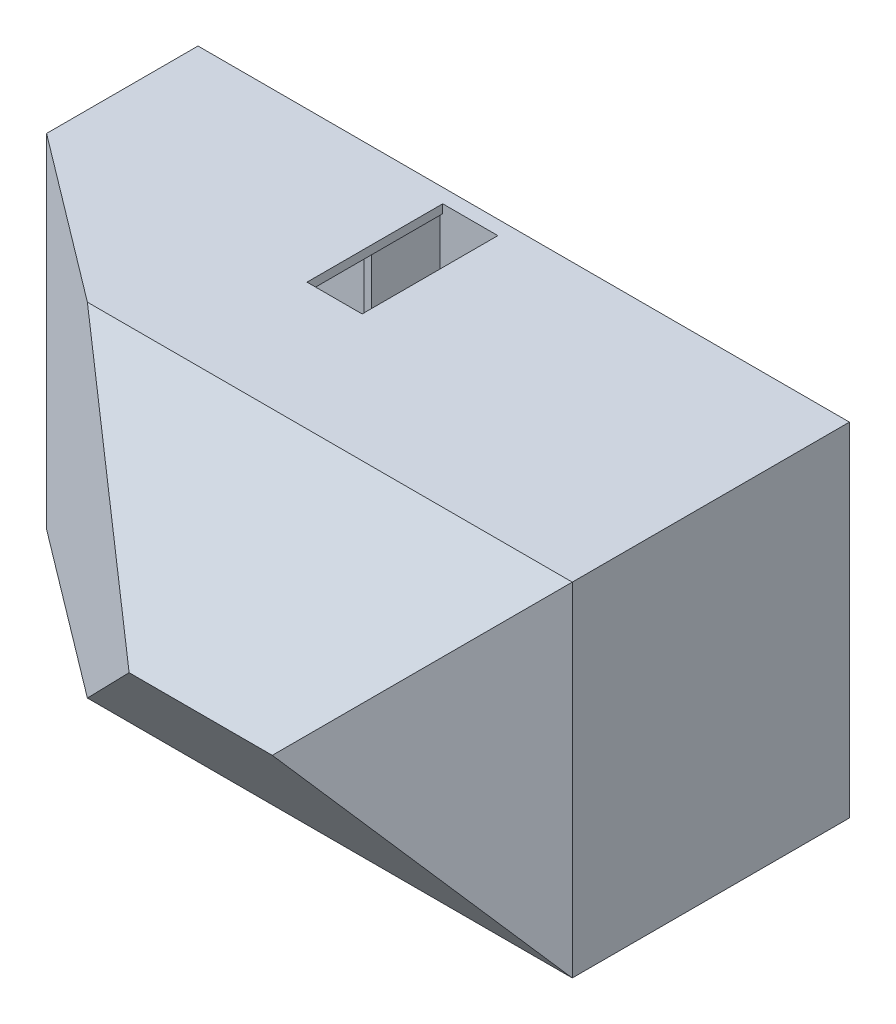
from build123d import *

# Parameters (mm, degrees)
SKETCH3_W                        = 11582.4
SKETCH3_H                        = 6096
SKETCH3_W_2                      = 3708.4
SKETCH3_H_2                      = 2342.798643186
SKETCH3_H_3                      = 2330.801356814
BOSS_EXTRUDE1_DEPTH              = 2438.4
SKETCH4_W                        = 11582.4
SKETCH4_H                        = 6096
BOSS_EXTRUDE2_DEPTH              = 254
BOSS_EXTRUDE3_DEPTH              = 914.4
SKETCH9_W                        = 865.543163862
SKETCH9_H                        = 991.415413209
CUT_EXTRUDE1_DEPTH               = 308.356
BOSS_EXTRUDE4_REACH              = 13183.499
BOSS_EXTRUDE7_DEPTH              = 254
BOSS_EXTRUDE7_DEPTH_BACK         = 25.4
CUT_EXTRUDE2_REACH               = 12509.597
BOSS_EXTRUDE8_DEPTH              = 1981.2
BOSS_EXTRUDE9_DEPTH              = 152.4
BOSS_EXTRUDE10_DEPTH             = 11509.502
BOSS_EXTRUDE11_REACH             = 14825.941
SKETCH17_W                       = 9126.052100072
SKETCH17_H                       = 6096
CUT_EXTRUDE3_DEPTH               = 3950.208
SKETCH18_W                       = 6162.012197425
SKETCH18_H                       = 5468.61546298
CUT_EXTRUDE4_DEPTH               = 3950.208
SKETCH19_W                       = 10778.647149002
SKETCH19_H                       = 6356.86992093
CUT_EXTRUDE5_DEPTH               = 3950.208
BOSS_EXTRUDE12_REACH             = 13849.543
SKETCH20_W                       = 3454.4
SKETCH20_H                       = 101.6
BOSS_EXTRUDE13_REACH             = 13849.543
SKETCH21_W                       = 101.6
SKETCH21_H                       = 1651
SKETCH22_W                       = 532.624565481
SKETCH22_H                       = 1281.986841564
CUT_EXTRUDE7_DEPTH               = 1185.672
SKETCH23_W                       = 128.189543518
SKETCH23_H                       = 2423.836870905
BOSS_EXTRUDE14_DEPTH             = 1219.2
BOSS_EXTRUDE15_REACH             = 14294.145
SKETCH24_W                       = 128.189543518
SKETCH24_H                       = 134.329985605
BOSS_EXTRUDE18_DEPTH             = 2399.284
BOSS_EXTRUDE18_DEPTH_BACK        = 2122.678
SKETCH26_W                       = 128.189543518
SKETCH26_H                       = 159.351168061
BOSS_EXTRUDE19_DEPTH             = 4241.8
BOSS_EXTRUDE19_DEPTH_BACK        = 3574.034
SKETCH27_W                       = 159.351168061
SKETCH27_H                       = 134.329985605
SKETCH33_W                       = 159.351168061
SKETCH33_H                       = 110.164485909
BOSS_EXTRUDE22_DEPTH             = 2592.07
BOSS_EXTRUDE23_DEPTH             = 2412.746
BOSS_EXTRUDE23_DEPTH_BACK        = 3589.528
SKETCH34_W                       = 128.189543518
SKETCH34_H                       = 150.52485229
BOSS_EXTRUDE24_REACH             = 11698.577
SKETCH35_W                       = 147.733032468
SKETCH35_H                       = 225.221764686
BOSS_EXTRUDE24_DIRECTION_2_DEPTH = 3311.398
SKETCH36_W                       = 117.495674419
SKETCH36_H                       = 147.733032468
BOSS_EXTRUDE25_DEPTH             = 2412.746
BOSS_EXTRUDE26_REACH             = 13768.706
SKETCH37_W                       = 172.313632774
SKETCH37_H                       = 139.095631101
BOSS_EXTRUDE27_DEPTH             = 3289.554
BOSS_EXTRUDE27_DEPTH_BACK        = 2668.016
SKETCH42_W                       = 172.313632774
SKETCH42_H                       = 147.733032468
SKETCH43_W                       = 171.607694654
SKETCH43_H                       = 159.351168061
BOSS_EXTRUDE28_DEPTH             = 3409.442
BOSS_EXTRUDE29_START             = 3519.763129095
BOSS_EXTRUDE29_DEPTH             = 134.329985605
SKETCH25_W                       = 5842
SKETCH25_H                       = 152.4
BOSS_EXTRUDE17_DEPTH             = 2235.2
BOSS_EXTRUDE20_REACH             = 14825.941
SKETCH29_W                       = 4249.880047705
SKETCH29_H                       = 6867.48766491
CUT_EXTRUDE8_DEPTH               = 4333.494
SKETCH30_W                       = 5475.233712052
SKETCH30_H                       = 5083.463062498
CUT_EXTRUDE9_DEPTH               = 4333.494
SKETCH31_W                       = 5267.827918063
SKETCH31_H                       = 4526.494518998
CUT_EXTRUDE10_DEPTH              = 4333.494
BOSS_EXTRUDE21_DEPTH             = 2687.32
SKETCH38_W                       = 5170.59012186
SKETCH38_H                       = 1946.673235559
CUT_EXTRUDE11_DEPTH              = 2412.746
SKETCH39_W                       = 8812.500446969
SKETCH39_H                       = 7026.305940655
CUT_EXTRUDE12_DEPTH              = 2412.746
SKETCH40_W                       = 7455.191850554
SKETCH40_H                       = 6034.724471262
CUT_EXTRUDE13_DEPTH              = 2412.746
SKETCH41_W                       = 6175.122976302
SKETCH41_H                       = 7375.841332805
CUT_EXTRUDE14_DEPTH              = 2412.746
SKETCH45_W                       = 5842
SKETCH45_H                       = 152.4
BOSS_EXTRUDE30_DEPTH             = 2235.2
SKETCH46_W                       = 6467.572168299
SKETCH46_H                       = 1492.516654223
CUT_EXTRUDE15_DEPTH              = 2235.2
SKETCH47_W                       = 980.476105055
SKETCH47_H                       = 2413
CUT_EXTRUDE16_DEPTH              = 2235.2
SKETCH48_W                       = 980.476105055
SKETCH48_H                       = 2413
CUT_EXTRUDE17_DEPTH              = 463.804
SKETCH49_W                       = 841.116574167
SKETCH49_H                       = 2290.952430173
CUT_EXTRUDE18_DEPTH              = 463.804
SKETCH50_W                       = 859.629187762
SKETCH50_H                       = 2304.601646796
CUT_EXTRUDE19_DEPTH              = 463.804
SKETCH51_W                       = 859.629187762
SKETCH51_H                       = 2304.601646796
CUT_EXTRUDE20_DEPTH              = 463.804
SKETCH52_W                       = 926.009779554
SKETCH52_H                       = 2273.025271102
CUT_EXTRUDE21_DEPTH              = 463.804


# Read off the part's stored shape, not the designer's step: Boss-Extrude29
with BuildPart() as part:
    # Sketch3 → Boss-Extrude1 (new body)
    with BuildSketch(Plane.XY):
        with Locations((5791.2, 3048)):
            Rectangle(SKETCH3_W, SKETCH3_H)
        Polygon((6096, 2495.198643186), (7620, 2495.198643186), (7620, 152.4), (7421.082242954, 152.4), (6096, 152.4), align=None, mode=Mode.SUBTRACT)
        with Locations((9575.8, 1323.799321593)):
            Rectangle(SKETCH3_W_2, SKETCH3_H_2, mode=Mode.SUBTRACT)
        Polygon((4452.687217937, 152.4), (152.4, 152.4), (152.4, 2489.2), (3454.4, 2489.2), (3454.4, 2590.8), (152.4, 2590.8), (152.4, 5943.6), (5973.282242954, 5943.6), (6074.882242954, 5943.6), (7620, 5943.6), (7620, 3621.363129095), (7620, 3519.763129095), (10289.03652981, 3519.763129095), (10390.63652981, 3519.763129095), (11430, 3511.198643186), (11430, 2596.798643186), (10390.63652981, 2605.363129095), (10289.03652981, 2605.363129095), (7620, 2605.363129095), (5994.4, 2605.363129095), (5994.4, 152.4), (4554.287217937, 152.4), (4554.287217937, 1803.4), (4452.687217937, 1803.4), align=None, mode=Mode.SUBTRACT)
        with Locations((9575.8, 4778.199321593)):
            Rectangle(SKETCH3_W_2, SKETCH3_H_3, mode=Mode.SUBTRACT)
    extrude(amount=BOSS_EXTRUDE1_DEPTH)

    # Sketch4 → Boss-Extrude2 (add)
    with BuildSketch(Plane(origin=(0, 0, 0), x_dir=(-1, 0, 0), z_dir=(0, 0, -1))):
        with Locations((-5791.2, 3048)):
            Rectangle(SKETCH4_W, SKETCH4_H)
    extrude(amount=BOSS_EXTRUDE2_DEPTH)

    # Sketch8 → Boss-Extrude3 (add)
    with BuildSketch(Plane.XZ.offset(-3519.763129095)):
        Polygon((8839.2, 0), (10563.649079736, 1446.984586791), (11430, 1446.984586791), (11430, 1319.984586791), (10609.873299488, 1319.984586791), (9036.776926011, 0), align=None)
    extrude(amount=BOSS_EXTRUDE3_DEPTH)

    # Sketch9 → Cut-Extrude1 (cut)
    with BuildSketch(Plane(origin=(22.172535688, 2690.800578374, 0), x_dir=(0.9999660518909057, -0.008239846219105333, 0), z_dir=(0.008239846219105333, 0.9999660518909057, 0))):
        with Locations((10967.071485942, -1942.692293396)):
            Rectangle(SKETCH9_W, SKETCH9_H)
    extrude(amount=-CUT_EXTRUDE1_DEPTH, mode=Mode.SUBTRACT)

    # Boss-Extrude4: up to this plane
    boss_extrude4_end = Plane(origin=(10553.574014115, 2295.654035243, 1446.984586791), z_dir=(-0.9999660518909057, 0.008239846219105333, 0))
    # Sketch10 → Boss-Extrude4 (add, up to the surface)
    with BuildSketch(Plane.ZY.offset(-11430), mode=Mode.PRIVATE) as boss_extrude4_sk1:
        Polygon((1446.984586791, 2605.363129095), (2438.4, 1423.840248649), (2438.4, 1313.675762741), (1446.984586791, 2495.198643186), (1319.984586791, 2495.198643186), (1319.984586791, 2605.363129095), align=None)
    boss_extrude4_tool1 = split(extrude(boss_extrude4_sk1.sketch, amount=BOSS_EXTRUDE4_REACH, mode=Mode.PRIVATE), bisect_by=boss_extrude4_end, keep=Keep.BOTH, mode=Mode.PRIVATE)
    add(boss_extrude4_tool1.solids().sort_by_distance((11430, 2026.602483, 1879.192293))[0])

    # Sketch11 → Boss-Extrude7 (add, two sides: drawn at the far end of the back side and taken through both)
    with BuildSketch(Plane.XY.offset(2438.4).offset(-BOSS_EXTRUDE7_DEPTH_BACK)):
        Polygon((5994.4, 2605.363129095), (5994.4, 0), (11582.4, 0), (11582.4, 1423.840248649), (11582.4, 3612.798643186), (11582.4, 6096), (7620, 6096), (5994.4, 6096), (5994.4, 5943.6), (7620, 5943.6), (7620, 3519.763129095), (7620, 2605.363129095), align=None)
        Polygon((11430, 1423.840248649), (10546.390158704, 1423.840248649), (10556.114820136, 2603.999567139), (9336.915582645, 2605.363129095), (9336.915582645, 3519.763129095), (11430, 3511.198643186), align=None, mode=Mode.SUBTRACT)
    extrude(amount=BOSS_EXTRUDE7_DEPTH + BOSS_EXTRUDE7_DEPTH_BACK)

    # Cut-Extrude2: up to this plane
    cut_extrude2_end = Plane(origin=(11430, 0, 2438.4), z_dir=(-1, 0, 0))
    # Sketch12 → Cut-Extrude2 (cut, up to the surface)
    with BuildSketch(Plane(origin=(10533.942284448, -86.801011235, 0), x_dir=(0, 0, -1), z_dir=(0.9999660518909057, -0.008239846219105333, 0)), mode=Mode.PRIVATE) as cut_extrude2_sk1:
        Polygon((-2438.4, 1519.229106813), (-2692.4, 1216.533970571), (-2692.4, 1519.229106813), align=None)
    cut_extrude2_tool1 = split(extrude(cut_extrude2_sk1.sketch, amount=CUT_EXTRUDE2_REACH, mode=Mode.PRIVATE), bisect_by=cut_extrude2_end, keep=Keep.BOTH, mode=Mode.PRIVATE)
    add(cut_extrude2_tool1.solids().sort_by_distance((10545.629112, 1331.481567, 2607.733333))[0], mode=Mode.SUBTRACT)

    # Sketch13 → Boss-Extrude8 (add)
    with BuildSketch(Plane.XY.offset(2692.4)):
        Polygon((7620, 6096), (11582.4, 6096), (11582.4, 3511.198643186), (11582.4, 0), (5994.4, 0), (5994.4, 152.4), (11430, 152.4), (11430, 3511.198643186), (9336.915582645, 3519.763129095), (9336.915582645, 2605.363129095), (7620, 2605.363129095), (7620, 5943.6), (5994.4, 5943.6), (5994.4, 6096), align=None)
        Polygon((7721.6, 2706.963129095), (7721.6, 5943.6), (11430, 5943.6), (11430, 3613.380649927), (9235.315582645, 3621.751379922), (9235.315582645, 2706.963129095), align=None, mode=Mode.SUBTRACT)
    extrude(amount=BOSS_EXTRUDE8_DEPTH)

    # Sketch14 → Boss-Extrude9 (add)
    with BuildSketch(Plane(origin=(11582.4, 0, 0), x_dir=(0, 0, -1), z_dir=(1, 0, 0))):
        Polygon((-4673.6, 0), (-4673.6, 6096), (-6959.6, 3048), align=None)
    extrude(amount=-BOSS_EXTRUDE9_DEPTH)

    # Sketch15 → Boss-Extrude10 (add)
    with BuildSketch(Plane.ZY.offset(-11430)):
        Polygon((4673.6, 6096), (6959.6, 3048), (4673.6, 0), (4673.6, 152.4), (6845.3, 3048), (4673.6, 5943.6), align=None)
    extrude(amount=BOSS_EXTRUDE10_DEPTH)

    # Boss-Extrude11: up to this face of the body (flat: up to its plane)
    boss_extrude11_end = Plane(part.part.faces().sort_by_distance((6648.35244623, 6096, 1796.808366816))[0])
    # Sketch16 → Boss-Extrude11 (add, up to the picked face)
    with BuildSketch(Plane.XZ, mode=Mode.PRIVATE) as boss_extrude11_sk1:
        Polygon((0, 2438.4), (5988.840887926, 6959.6), (5988.840887926, 6845.3), (152.4, 2438.4), align=None)
    boss_extrude11_tool1 = split(extrude(boss_extrude11_sk1.sketch, amount=-BOSS_EXTRUDE11_REACH, mode=Mode.PRIVATE), bisect_by=boss_extrude11_end, keep=Keep.BOTH, mode=Mode.PRIVATE)
    add(boss_extrude11_tool1.solids().sort_by(Axis((3029.082751, 0, 4668.075048), (0, 1, 0)))[0])

    # Sketch17 → Cut-Extrude3 (cut)
    with BuildSketch(Plane(origin=(-1172.561069115, 0, 1553.189789061), x_dir=(0.7981045533386113, 0, 0.6025189805642441), z_dir=(-0.6025189805642441, 0, 0.7981045533386113))):
        with Locations((4409.986228973, 3048)):
            Rectangle(SKETCH17_W, SKETCH17_H)
    extrude(amount=CUT_EXTRUDE3_DEPTH, mode=Mode.SUBTRACT)

    # Sketch18 → Cut-Extrude4 (cut)
    with BuildSketch(Plane(origin=(0, -2243.328, 2991.104), x_dir=(1, 0, 0), z_dir=(0, -0.6000000000000002, 0.7999999999999999))):
        with Locations((4789.474642924, 4319.26773149)):
            Rectangle(SKETCH18_W, SKETCH18_H)
    extrude(amount=CUT_EXTRUDE4_DEPTH, mode=Mode.SUBTRACT)

    # Sketch19 → Cut-Extrude5 (cut)
    with BuildSketch(Plane(origin=(0, 4437.888, 5917.184), x_dir=(1, 0, 0), z_dir=(0, 0.5999999999999998, 0.8000000000000004))):
        with Locations((7188.072546938, 83.612963585)):
            Rectangle(SKETCH19_W, SKETCH19_H)
    extrude(amount=CUT_EXTRUDE5_DEPTH, mode=Mode.SUBTRACT)

    # Boss-Extrude12: up to this face of the body (flat: up to its plane)
    boss_extrude12_end = Plane(part.part.faces().sort_by_distance((2402.66330701, 3048, 4137.498056176))[0])
    # Sketch20 → Boss-Extrude12 (add, up to the picked face)
    with BuildSketch(Plane.XY.offset(2438.4), mode=Mode.PRIVATE) as boss_extrude12_sk1:
        with Locations((1727.2, 2540)):
            Rectangle(SKETCH20_W, SKETCH20_H)
    boss_extrude12_tool1 = split(extrude(boss_extrude12_sk1.sketch, amount=BOSS_EXTRUDE12_REACH, mode=Mode.PRIVATE), bisect_by=boss_extrude12_end, keep=Keep.BOTH, mode=Mode.PRIVATE)
    add(boss_extrude12_tool1.solids().sort_by(Axis((1727.2, 2540, 2438.4), (0, 0, 1)))[0])

    # Boss-Extrude13: up to this plane
    boss_extrude13_end = Plane(origin=(11430, 0, 4673.6), z_dir=(0, -0.6000000000000002, 0.7999999999999999))
    # Sketch21 → Boss-Extrude13 (add, up to the surface)
    with BuildSketch(Plane.XY.offset(2438.4), mode=Mode.PRIVATE) as boss_extrude13_sk1:
        with Locations((4503.487217937, 977.9)):
            Rectangle(SKETCH21_W, SKETCH21_H)
    boss_extrude13_tool1 = split(extrude(boss_extrude13_sk1.sketch, amount=BOSS_EXTRUDE13_REACH, mode=Mode.PRIVATE), bisect_by=boss_extrude13_end, keep=Keep.BOTH, mode=Mode.PRIVATE)
    add(boss_extrude13_tool1.solids().sort_by_distance((4503.487218, 977.9, 2438.4))[0])

    # Sketch22 → Cut-Extrude7 (cut)
    with BuildSketch(Plane(origin=(-1172.561069115, 0, 1553.189789061), x_dir=(0.7981045533386113, 0, 0.6025189805642441), z_dir=(-0.6025189805642441, 0, 0.7981045533386113))):
        with Locations((7037.092924102, 1579.089259508)):
            Rectangle(SKETCH22_W, SKETCH22_H)
    extrude(amount=CUT_EXTRUDE7_DEPTH, mode=Mode.SUBTRACT)

    # Sketch23 → Boss-Extrude14 (add)
    with BuildSketch(Plane.XY):
        with Locations((4490.192446178, 4731.681564547)):
            Rectangle(SKETCH23_W, SKETCH23_H)
    extrude(amount=BOSS_EXTRUDE14_DEPTH)

    # Boss-Extrude15: up to this plane
    boss_extrude15_end = Plane(origin=(152.4, 13599.829996801, 2438.4), z_dir=(0.6025845157633412, 0, -0.7980550741410393))
    # Sketch24 → Boss-Extrude15 (add, up to the surface)
    with BuildSketch(Plane.XY.offset(1219.2), mode=Mode.PRIVATE) as boss_extrude15_sk1:
        with Locations((4490.192446178, 3586.928121898)):
            Rectangle(SKETCH24_W, SKETCH24_H)
    boss_extrude15_tool1 = split(extrude(boss_extrude15_sk1.sketch, amount=BOSS_EXTRUDE15_REACH, mode=Mode.PRIVATE), bisect_by=boss_extrude15_end, keep=Keep.BOTH, mode=Mode.PRIVATE)
    add(boss_extrude15_tool1.solids().sort_by_distance((4490.192446, 3586.928122, 1219.2))[0])

    # Sketch26 → Boss-Extrude18 (add, two sides: drawn at the far end of the back side and taken through both)
    with BuildSketch(Plane(origin=(0, 3654.0931147, 0), x_dir=(1, 0, 0), z_dir=(0, 1, 0)).offset(-BOSS_EXTRUDE18_DEPTH_BACK)):
        with Locations((4490.192446178, -2492.67558403)):
            Rectangle(SKETCH26_W, SKETCH26_H)
    extrude(amount=BOSS_EXTRUDE18_DEPTH + BOSS_EXTRUDE18_DEPTH_BACK)

    # Sketch27 → Boss-Extrude19 (add, two sides: drawn at the far end of the back side and taken through both)
    with BuildSketch(Plane.ZY.offset(-4426.097674419).offset(-BOSS_EXTRUDE19_DEPTH_BACK)):
        with Locations((2492.67558403, 3586.928121898)):
            Rectangle(SKETCH27_W, SKETCH27_H)
    extrude(amount=BOSS_EXTRUDE19_DEPTH + BOSS_EXTRUDE19_DEPTH_BACK)

    # Sketch33 → Boss-Extrude22 (add)
    with BuildSketch(Plane.ZY.offset(-5994.4)):
        with Locations((2492.67558403, 2550.280886141)):
            Rectangle(SKETCH33_W, SKETCH33_H)
    extrude(amount=BOSS_EXTRUDE22_DEPTH)

    # Sketch34 → Boss-Extrude23 (add, two sides: drawn at the far end of the back side and taken through both)
    with BuildSketch(Plane(origin=(0, 3654.0931147, 0), x_dir=(1, 0, 0), z_dir=(0, 1, 0)).offset(-BOSS_EXTRUDE23_DEPTH_BACK)):
        with Locations((4490.192446178, -4598.337573855)):
            Rectangle(SKETCH34_W, SKETCH34_H)
    extrude(amount=BOSS_EXTRUDE23_DEPTH + BOSS_EXTRUDE23_DEPTH_BACK)

    # Boss-Extrude24: up to this plane
    boss_extrude24_end = Plane(origin=(152.4, 13599.829996801, 2438.4), z_dir=(0.6025845157633412, 0, -0.7980550741410393))
    # Sketch35 → Boss-Extrude24 (add, up to the surface)
    with BuildSketch(Plane.ZY.offset(-4426.097674419), mode=Mode.PRIVATE) as boss_extrude24_sk1:
        with Locations((4599.733483766, 2601.810882343)):
            Rectangle(SKETCH35_W, SKETCH35_H)
    boss_extrude24_tool1 = split(extrude(boss_extrude24_sk1.sketch, amount=BOSS_EXTRUDE24_REACH, mode=Mode.PRIVATE), bisect_by=boss_extrude24_end, keep=Keep.BOTH, mode=Mode.PRIVATE)
    add(boss_extrude24_tool1.solids().sort_by_distance((4426.097674, 2601.810882, 4599.733484))[0])

    # Sketch35 → Boss-Extrude24 direction 2 (add)
    with BuildSketch(Plane.ZY.offset(-4426.097674419)):
        with Locations((4599.733483766, 2601.810882343)):
            Rectangle(SKETCH35_W, SKETCH35_H)
    extrude(amount=-BOSS_EXTRUDE24_DIRECTION_2_DEPTH)

    # Sketch36 → Boss-Extrude25 (add)
    with BuildSketch(Plane.XZ.offset(-2489.2)):
        with Locations((7678.74783721, 4599.733483766)):
            Rectangle(SKETCH36_W, SKETCH36_H)
    extrude(amount=BOSS_EXTRUDE25_DEPTH)

    # Boss-Extrude26: up to this plane
    boss_extrude26_end = Plane(origin=(-79.502, 152.4, 4673.6), z_dir=(0, -0.5999999999999998, 0.8000000000000003))
    # Sketch37 → Boss-Extrude26 (add, up to the surface)
    with BuildSketch(Plane.XY.offset(2692.4), mode=Mode.PRIVATE) as boss_extrude26_sk1:
        with Locations((6080.556816387, 2535.815313544)):
            Rectangle(SKETCH37_W, SKETCH37_H)
    boss_extrude26_tool1 = split(extrude(boss_extrude26_sk1.sketch, amount=BOSS_EXTRUDE26_REACH, mode=Mode.PRIVATE), bisect_by=boss_extrude26_end, keep=Keep.BOTH, mode=Mode.PRIVATE)
    add(boss_extrude26_tool1.solids().sort_by_distance((6080.556816, 2535.815314, 2692.4))[0])

    # Sketch42 → Boss-Extrude27 (add, two sides: drawn at the far end of the back side and taken through both)
    with BuildSketch(Plane(origin=(0, 2714.421764686, 0), x_dir=(1, 0, 0), z_dir=(0, 1, 0)).offset(-BOSS_EXTRUDE27_DEPTH_BACK)):
        with Locations((6080.556816387, -4599.733483766)):
            Rectangle(SKETCH42_W, SKETCH42_H)
    extrude(amount=BOSS_EXTRUDE27_DEPTH + BOSS_EXTRUDE27_DEPTH_BACK)

    # Sketch43 → Boss-Extrude28 (add)
    with BuildSketch(Plane(origin=(0, 2605.363129095, 0), x_dir=(1, 0, 0), z_dir=(0, 1, 0))):
        with Locations((6080.203847327, -2492.67558403)):
            Rectangle(SKETCH43_W, SKETCH43_H)
    extrude(amount=BOSS_EXTRUDE28_DEPTH)

    # Boss-Extrude29 outline → Boss-Extrude29 (add)
    with BuildSketch(Plane(origin=(0, 0, 0), x_dir=(1, 0, 0), z_dir=(0, 1, 0)).offset(BOSS_EXTRUDE29_START)):
        Polygon((2913.316578578, -4523.07514771), (3112.669729899, -4673.6), (4426.097674419, -4673.6), (4426.097674419, -4523.07514771), align=None)
        Polygon((4554.287217937, -4673.6), (5994.4, -4673.6), (5994.4, -4525.866967532), (6166.713632774, -4525.866967532), (6166.713632774, -4673.6), (7620, -4673.6), (7620, -4523.07514771), (4554.287217937, -4523.07514771), align=None)
    extrude(amount=BOSS_EXTRUDE29_DEPTH)

    # Sketch25 → Boss-Extrude17 (add)
    with BuildSketch(Plane.XY.offset(2438.4)):
        with Locations((3073.4, 76.2)):
            Rectangle(SKETCH25_W, SKETCH25_H)
    extrude(amount=BOSS_EXTRUDE17_DEPTH)

    # Boss-Extrude20: up to this face of the body (flat: up to its plane)
    boss_extrude20_end = Plane(part.part.faces().sort_by_distance((5824.630568399, 0, 2201.759416204))[0])
    # Sketch28 → Boss-Extrude20 (add, up to the picked face)
    with BuildSketch(Plane(origin=(0, 6096, 0), x_dir=(1, 0, 0), z_dir=(0, 1, 0)), mode=Mode.PRIVATE) as boss_extrude20_sk1:
        Polygon((11582.4, -4673.6), (11277.6, -4902.2), (8534.4, -6959.6), (8382, -6959.6), (11430, -4673.6), align=None)
    boss_extrude20_tool1 = split(extrude(boss_extrude20_sk1.sketch, amount=-BOSS_EXTRUDE20_REACH, mode=Mode.PRIVATE), bisect_by=boss_extrude20_end, keep=Keep.BOTH, mode=Mode.PRIVATE)
    add(boss_extrude20_tool1.solids().sort_by(Axis((9982.2, 6096, 5816.6), (0, -1, 0)))[0])

    # Sketch29 → Cut-Extrude8 (cut)
    with BuildSketch(Plane(origin=(6412.992, 0, 8550.656), x_dir=(0.8, 0, -0.6), z_dir=(0.6, 0, 0.8))):
        with Locations((4676.549859137, 2949.190131975)):
            Rectangle(SKETCH29_W, SKETCH29_H)
    extrude(amount=CUT_EXTRUDE8_DEPTH, mode=Mode.SUBTRACT)

    # Sketch30 → Cut-Extrude9 (cut)
    with BuildSketch(Plane(origin=(0, -2243.328, 2991.104), x_dir=(1, 0, 0), z_dir=(0, -0.6000000000000003, 0.7999999999999999))):
        with Locations((9740.965191179, 4457.506746783)):
            Rectangle(SKETCH30_W, SKETCH30_H)
    extrude(amount=CUT_EXTRUDE9_DEPTH, mode=Mode.SUBTRACT)

    # Sketch31 → Cut-Extrude10 (cut)
    with BuildSketch(Plane(origin=(0, 4437.888, 5917.184), x_dir=(1, 0, 0), z_dir=(0, 0.6, 0.8))):
        with Locations((9855.451340757, 112.743501572)):
            Rectangle(SKETCH31_W, SKETCH31_H)
    extrude(amount=CUT_EXTRUDE10_DEPTH, mode=Mode.SUBTRACT)

    # Sketch32 → Boss-Extrude21 (add)
    with BuildSketch(Plane.XY.offset(4673.6)):
        Polygon((7620, 5943.6), (7620, 2605.363129095), (9336.915582645, 2605.363129095), (9336.915582645, 3519.763129095), (11430, 3511.198643186), (11430, 3613.380649927), (9235.315582645, 3621.751379922), (9235.315582645, 2706.963129095), (7721.6, 2706.963129095), (7721.6, 5943.6), align=None)
    extrude(amount=BOSS_EXTRUDE21_DEPTH)

    # Sketch38 → Cut-Extrude11 (cut)
    with BuildSketch(Plane(origin=(-1172.561069115, 0, 1553.189789061), x_dir=(0.7981045533386111, 0, 0.6025189805642442), z_dir=(-0.6025189805642442, 0, 0.7981045533386111))):
        with Locations((3185.033968182, 16.696326161)):
            Rectangle(SKETCH38_W, SKETCH38_H)
    extrude(amount=CUT_EXTRUDE11_DEPTH, mode=Mode.SUBTRACT)

    # Sketch39 → Cut-Extrude12 (cut)
    with BuildSketch(Plane(origin=(0, 4437.888, 5917.184), x_dir=(1, 0, 0), z_dir=(0, 0.6, 0.8))):
        with Locations((8852.798105875, 1700.649303399)):
            Rectangle(SKETCH39_W, SKETCH39_H)
    extrude(amount=CUT_EXTRUDE12_DEPTH, mode=Mode.SUBTRACT)

    # Sketch40 → Cut-Extrude13 (cut)
    with BuildSketch(Plane(origin=(0, -2243.328, 2991.104), x_dir=(1, 0, 0), z_dir=(0, -0.6000000000000003, 0.7999999999999999))):
        with Locations((10503.513777939, 4914.283391166)):
            Rectangle(SKETCH40_W, SKETCH40_H)
    extrude(amount=CUT_EXTRUDE13_DEPTH, mode=Mode.SUBTRACT)

    # Sketch41 → Cut-Extrude14 (cut)
    with BuildSketch(Plane(origin=(6412.992, 0, 8550.656), x_dir=(0.8, 0, -0.6), z_dir=(0.6, 0, 0.8))):
        with Locations((5065.956106825, 2899.557218464)):
            Rectangle(SKETCH41_W, SKETCH41_H)
    extrude(amount=CUT_EXTRUDE14_DEPTH, mode=Mode.SUBTRACT)

    # Sketch45 → Boss-Extrude30 (add)
    with BuildSketch(Plane.XY.offset(2438.4)):
        with Locations((3073.4, 6019.8)):
            Rectangle(SKETCH45_W, SKETCH45_H)
    extrude(amount=BOSS_EXTRUDE30_DEPTH)

    # Sketch46 → Cut-Extrude15 (cut)
    with BuildSketch(Plane(origin=(-1172.561069115, 0, 1553.189789061), x_dir=(0.7981045533386111, 0, 0.6025189805642442), z_dir=(-0.6025189805642442, 0, 0.7981045533386111))):
        with Locations((2602.363649901, 6093.815626844)):
            Rectangle(SKETCH46_W, SKETCH46_H)
    extrude(amount=CUT_EXTRUDE15_DEPTH, mode=Mode.SUBTRACT)

    # Sketch47 → Cut-Extrude16 (cut)
    with BuildSketch(Plane.XZ):
        with Locations((5095.412378664, 1206.5)):
            Rectangle(SKETCH47_W, SKETCH47_H)
    extrude(amount=-CUT_EXTRUDE16_DEPTH, mode=Mode.SUBTRACT)

    # Sketch48 → Cut-Extrude17 (cut)
    with BuildSketch(Plane(origin=(0, 6096, 0), x_dir=(1, 0, 0), z_dir=(0, 1, 0))):
        with Locations((5095.412378664, -1206.5)):
            Rectangle(SKETCH48_W, SKETCH48_H)
    extrude(amount=-CUT_EXTRUDE17_DEPTH, mode=Mode.SUBTRACT)

    # Sketch49 → Cut-Extrude18 (cut)
    with BuildSketch(Plane(origin=(0, 2605.363129095, 0), x_dir=(1, 0, 0), z_dir=(0, 1, 0))):
        with Locations((6627.856212895, -1145.476215087)):
            Rectangle(SKETCH49_W, SKETCH49_H)
    extrude(amount=-CUT_EXTRUDE18_DEPTH, mode=Mode.SUBTRACT)

    # Sketch50 → Cut-Extrude19 (cut)
    with BuildSketch(Plane(origin=(0, 2605.363129095, 0), x_dir=(1, 0, 0), z_dir=(0, 1, 0))):
        with Locations((8261.394007791, -1152.300823398)):
            Rectangle(SKETCH50_W, SKETCH50_H)
    extrude(amount=-CUT_EXTRUDE19_DEPTH, mode=Mode.SUBTRACT)

    # Sketch51 → Cut-Extrude20 (cut)
    with BuildSketch(Plane.XZ.offset(-3519.763129095)):
        with Locations((8261.394007791, 1152.300823398)):
            Rectangle(SKETCH51_W, SKETCH51_H)
    extrude(amount=-CUT_EXTRUDE20_DEPTH, mode=Mode.SUBTRACT)

    # Sketch52 → Cut-Extrude21 (cut)
    with BuildSketch(Plane.XZ.offset(-2605.363129095)):
        with Locations((8677.976304577, 3828.912635551)):
            Rectangle(SKETCH52_W, SKETCH52_H)
    extrude(amount=-CUT_EXTRUDE21_DEPTH, mode=Mode.SUBTRACT)


solid = part.part
